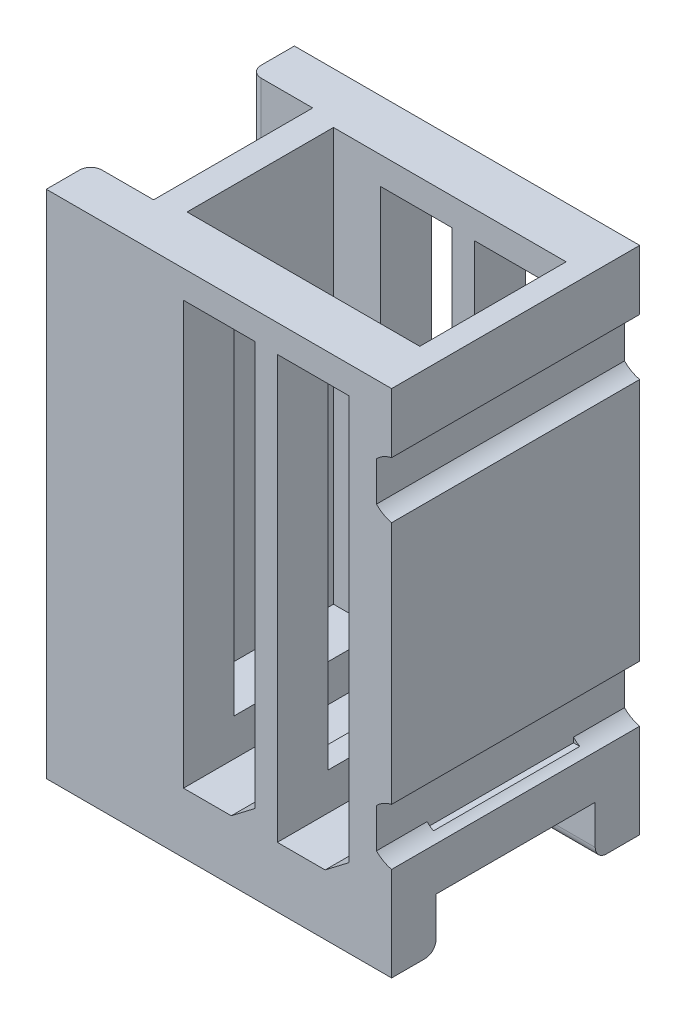
from build123d import *

# Parameters (mm, degrees)
BOSS_EXTRUDE1_DEPTH = 55
SKETCH2_W           = 46
SKETCH2_H           = 13
BOSS_EXTRUDE2_DEPTH = 33.046593186
CUT_EXTRUDE1_DEPTH  = 77.370876735
SKETCH4_W           = 3
SKETCH4_H           = 21.2
CUT_EXTRUDE2_DEPTH  = 81.445701024
CUT_EXTRUDE5_DEPTH  = 55
BOSS_EXTRUDE3_START = -33.046593
SKETCH6_W           = 29.264894646
SKETCH6_H           = 6.300081486
BOSS_EXTRUDE3_DEPTH = 33.046593
SKETCH7_W           = 21.2
SKETCH7_H           = 6.716582595
CUT_EXTRUDE6_DEPTH  = 77.370876735
SKETCH8_W           = 3.134420474
SKETCH8_H           = 7.5
CUT_EXTRUDE7_DEPTH  = 55
FILLET1_R           = 4
BOSS_EXTRUDE4_START = -33.046593
SKETCH9_W           = 1.727441698
SKETCH9_H           = 54.56683481
BOSS_EXTRUDE4_DEPTH = 33.046593
SKETCH10_W          = 0.74410578
SKETCH10_H          = 19.5
CUT_EXTRUDE8_DEPTH  = 59.962432577
FILLET2_R           = 1.5


with BuildPart() as part:
    # Sketch1 → Boss-Extrude1 (new body)
    with BuildSketch(Plane(origin=(0, 0, 0), x_dir=(1, 0, 0), z_dir=(0, 1, 0))):
        Polygon((31, -3.75), (31, 0), (0, 0), (0, 19.5), (31, 19.5), (31, 23.296593186), (34, 23.296593186), (34, 26.296593186), (-12, 26.296593186), (-12, -6.75), (34, -6.75), (34, -3.75), align=None)
        Polygon((31, 9.75), (31, 0), (31, -3.75), (34, -3.75), (34, 23.296593186), (31, 23.296593186), (31, 19.5), align=None)
    extrude(amount=BOSS_EXTRUDE1_DEPTH)

    # Sketch2 → Boss-Extrude2 (add)
    with BuildSketch(Plane.XY.offset(6.75)):
        with Locations((11, -6.5)):
            Rectangle(SKETCH2_W, SKETCH2_H)
    extrude(amount=-BOSS_EXTRUDE2_DEPTH)

    # Sketch3 → Cut-Extrude1 (cut, through all)
    with BuildSketch(Plane(origin=(34, 0, 0), x_dir=(0, 0, -1), z_dir=(1, 0, 0))):
        Polygon((-0.826703407, -6.283417405), (-0.826703407, -13), (9.773296593, -13), (20.373296593, -13), (20.373296593, -6.283417405), align=None)
    extrude(amount=-CUT_EXTRUDE1_DEPTH, mode=Mode.SUBTRACT)

    # Sketch4 → Cut-Extrude2 (cut, through all)
    with BuildSketch(Plane(origin=(0, 55, 0), x_dir=(1, 0, 0), z_dir=(0, 1, 0))):
        with Locations((-5.132099024, 9.773296593)):
            Rectangle(SKETCH4_W, SKETCH4_H)
        Polygon((-12, 20.373296593), (-12, 9.773296593), (-12, -0.826703407), (-6.632099024, -0.826703407), (-6.632099024, 20.373296593), align=None)
    extrude(amount=-CUT_EXTRUDE2_DEPTH, mode=Mode.SUBTRACT)

    # Sketch5 → Cut-Extrude5 (cut)
    with BuildSketch(Plane.XY.offset(6.75)):
        Polygon((28.325224087, 51.33184393), (18.77348764, 51.33184393), (18.77348764, 44.015620269), (18.77348764, -9.839915018), (28.325224087, -2.523691356), align=None)
        Polygon((6.27348764, -9.839915018), (6.27348764, 44.015620269), (6.27348764, 51.33184393), (15.825224087, 51.33184393), (15.825224087, -2.523691356), align=None)
    extrude(amount=-CUT_EXTRUDE5_DEPTH, mode=Mode.SUBTRACT)

    # Sketch6 → Boss-Extrude3 (add)
    with BuildSketch(Plane.XY.offset(6.75).offset(BOSS_EXTRUDE3_START)):
        with Locations((18.265416553, -8.11247332)):
            Rectangle(SKETCH6_W, SKETCH6_H)
    extrude(amount=BOSS_EXTRUDE3_DEPTH)

    # Sketch7 → Cut-Extrude6 (cut, through all)
    with BuildSketch(Plane(origin=(34, 0, 0), x_dir=(0, 0, -1), z_dir=(1, 0, 0))):
        with Locations((9.773296593, -9.641708703)):
            Rectangle(SKETCH7_W, SKETCH7_H)
    extrude(amount=-CUT_EXTRUDE6_DEPTH, mode=Mode.SUBTRACT)

    # Sketch8 → Cut-Extrude7 (cut)
    with BuildSketch(Plane.XY.offset(6.75)):
        with Locations((32.432789763, 3.278045091)):
            Rectangle(SKETCH8_W, SKETCH8_H)
        with Locations((32.432789763, 43.278045091)):
            Rectangle(SKETCH8_W, SKETCH8_H)
    extrude(amount=-CUT_EXTRUDE7_DEPTH, mode=Mode.SUBTRACT)

    # Fillet1
    # the kernel refuses this fillet: 4 mm, written as the material it adds along each edge
    with BuildSketch(Plane(origin=(30.865579526, -0.471954909, 6.75), x_dir=(1, 0, 0), z_dir=(0, 0, -1))) as fillet1_piece_1_section:
        with BuildLine():
            CenterArc((4, -3.905223692), FILLET1_R, 102.497374798, 77.502625202)
            Line((0, -3.905223692), (-0.08, -3.905223692))
            Line((-0.08, -3.905223692), (-0.08, 0))
            Line((-0.08, 0), (0, 0.08))
            ThreePointArc((0, 0.08), (1.567210237, 0.08), (3.117108884, 0.078104474))
            Line((3.117108884, 0.078104474), (3.134420474, 0))
        make_face()
    fillet1_piece_1 = extrude(amount=33.046593186, mode=Mode.PRIVATE)
    fillet1_piece_1 = split(fillet1_piece_1, bisect_by=Plane(origin=(32.12921107, 0, 3.375), z_dir=(0, -1, 0)), keep=Keep.TOP, mode=Mode.PRIVATE)
    fillet1_piece_1 = split(fillet1_piece_1, bisect_by=Plane(origin=(32.12921107, -0.298742451, 0), z_dir=(0, 0, 1)), keep=Keep.TOP, mode=Mode.PRIVATE)
    add(fillet1_piece_1)
    with BuildSketch(Plane(origin=(30.865579526, -0.471954909, 6.75), x_dir=(1, 0, 0), z_dir=(0, 0, -1))) as fillet1_piece_2_section:
        with BuildLine():
            CenterArc((4, -3.905223692), FILLET1_R, 102.497374798, 77.502625202)
            Line((0, -3.905223692), (-0.08, -3.905223692))
            Line((-0.08, -3.905223692), (-0.08, 0))
            Line((-0.08, 0), (0, 0.08))
            ThreePointArc((0, 0.08), (1.567210237, 0.08), (3.117108884, 0.078104474))
            Line((3.117108884, 0.078104474), (3.134420474, 0))
        make_face()
    fillet1_piece_2 = extrude(amount=33.046593186, mode=Mode.PRIVATE)
    fillet1_piece_2 = split(fillet1_piece_2, bisect_by=Plane(origin=(31.341073978, 0, 3.375), z_dir=(0, 1, 0)), keep=Keep.TOP, mode=Mode.PRIVATE)
    fillet1_piece_2 = split(fillet1_piece_2, bisect_by=Plane(origin=(31.341073978, 0.922666131, 0), z_dir=(0, 0, 1)), keep=Keep.TOP, mode=Mode.PRIVATE)
    add(fillet1_piece_2)
    with BuildSketch(Plane(origin=(30.865579526, -0.471954909, 6.75), x_dir=(1, 0, 0), z_dir=(0, 0, -1))) as fillet1_piece_3_section:
        with BuildLine():
            CenterArc((4, -3.905223692), FILLET1_R, 102.497374798, 77.502625202)
            Line((0, -3.905223692), (-0.08, -3.905223692))
            Line((-0.08, -3.905223692), (-0.08, 0))
            Line((-0.08, 0), (0, 0.08))
            ThreePointArc((0, 0.08), (1.567210237, 0.08), (3.117108884, 0.078104474))
            Line((3.117108884, 0.078104474), (3.134420474, 0))
        make_face()
    fillet1_piece_3 = extrude(amount=33.046593186, mode=Mode.PRIVATE)
    fillet1_piece_3 = split(fillet1_piece_3, bisect_by=Plane(origin=(32.12921107, -0.298742451, -19.5), z_dir=(0, 0, 1)), keep=Keep.TOP, mode=Mode.PRIVATE)
    fillet1_piece_3 = split(fillet1_piece_3, bisect_by=Plane(origin=(32.12921107, 0, -9.75), z_dir=(0, -1, 0)), keep=Keep.TOP, mode=Mode.PRIVATE)
    fillet1_piece_3 = split(fillet1_piece_3, bisect_by=Plane(origin=(32.12921107, -0.298742451, 0), z_dir=(0, 0, -1)), keep=Keep.TOP, mode=Mode.PRIVATE)
    add(fillet1_piece_3)
    with BuildSketch(Plane(origin=(30.865579526, -0.471954909, 6.75), x_dir=(1, 0, 0), z_dir=(0, 0, -1))) as fillet1_piece_4_section:
        with BuildLine():
            CenterArc((4, -3.905223692), FILLET1_R, 102.497374798, 77.502625202)
            Line((0, -3.905223692), (-0.08, -3.905223692))
            Line((-0.08, -3.905223692), (-0.08, 0))
            Line((-0.08, 0), (0, 0.08))
            ThreePointArc((0, 0.08), (1.567210237, 0.08), (3.117108884, 0.078104474))
            Line((3.117108884, 0.078104474), (3.134420474, 0))
        make_face()
    fillet1_piece_4 = extrude(amount=33.046593186, mode=Mode.PRIVATE)
    fillet1_piece_4 = split(fillet1_piece_4, bisect_by=Plane(origin=(32.12921107, -0.298742451, -19.5), z_dir=(0, 0, -1)), keep=Keep.TOP, mode=Mode.PRIVATE)
    fillet1_piece_4 = split(fillet1_piece_4, bisect_by=Plane(origin=(32.12921107, 0, -22.898296593), z_dir=(0, -1, 0)), keep=Keep.TOP, mode=Mode.PRIVATE)
    add(fillet1_piece_4)
    with BuildSketch(Plane(origin=(30.865579526, -0.471954909, 6.75), x_dir=(1, 0, 0), z_dir=(0, 0, -1))) as fillet1_piece_5_section:
        with BuildLine():
            CenterArc((4, -3.905223692), FILLET1_R, 102.497374798, 77.502625202)
            Line((0, -3.905223692), (-0.08, -3.905223692))
            Line((-0.08, -3.905223692), (-0.08, 0))
            Line((-0.08, 0), (0, 0.08))
            ThreePointArc((0, 0.08), (1.567210237, 0.08), (3.117108884, 0.078104474))
            Line((3.117108884, 0.078104474), (3.134420474, 0))
        make_face()
    fillet1_piece_5 = extrude(amount=33.046593186, mode=Mode.PRIVATE)
    fillet1_piece_5 = split(fillet1_piece_5, bisect_by=Plane(origin=(31.341073978, 0.922666131, -19.5), z_dir=(0, 0, -1)), keep=Keep.TOP, mode=Mode.PRIVATE)
    fillet1_piece_5 = split(fillet1_piece_5, bisect_by=Plane(origin=(31.341073978, 0, -22.898296593), z_dir=(0, 1, 0)), keep=Keep.TOP, mode=Mode.PRIVATE)
    add(fillet1_piece_5)
    with BuildSketch(Plane(origin=(30.865579526, 7.028045091, -9.73694077), x_dir=(0, -1, 0), z_dir=(0, 0, -1))) as fillet1_piece_6_section:
        with BuildLine():
            CenterArc((3.905223692, -4), FILLET1_R, 90, 77.502625202)
            Line((0, -3.134420474), (-0.078104474, -3.117108884))
            ThreePointArc((-0.078104474, -3.117108884), (-0.08, -1.567210237), (-0.08, 0))
            Line((-0.08, 0), (0, 0.08))
            Line((0, 0.08), (3.905223692, 0.08))
            Line((3.905223692, 0.08), (3.905223692, 0))
        make_face()
    fillet1_piece_6 = extrude(amount=16.559652417, mode=Mode.PRIVATE)
    fillet1_piece_6 = split(fillet1_piece_6, bisect_by=Plane(origin=(31.850173209, 6.325117435, -19.5), z_dir=(0, 0, 1)), keep=Keep.TOP, mode=Mode.PRIVATE)
    fillet1_piece_6 = split(fillet1_piece_6, bisect_by=Plane(origin=(31, 6.325117435, -14.618470385), z_dir=(1, 0, 0)), keep=Keep.TOP, mode=Mode.PRIVATE)
    add(fillet1_piece_6)
    with BuildSketch(Plane(origin=(30.865579526, 7.028045091, -19.5), x_dir=(0, -1, 0), z_dir=(0, 0, -1))) as fillet1_piece_7_section:
        with BuildLine():
            CenterArc((3.905223692, -4), FILLET1_R, 90, 77.502625202)
            Line((0, -3.134420474), (-0.078104474, -3.117108884))
            ThreePointArc((-0.078104474, -3.117108884), (-0.08, -1.567210237), (-0.08, 0))
            Line((-0.08, 0), (0, 0.08))
            Line((0, 0.08), (3.905223692, 0.08))
            Line((3.905223692, 0.08), (3.905223692, 0))
        make_face()
    fillet1_piece_7 = extrude(amount=6.796593186, mode=Mode.PRIVATE)
    fillet1_piece_7 = split(fillet1_piece_7, bisect_by=Plane(origin=(31, 5.302848629, -22.898296593), z_dir=(-1, 0, 0)), keep=Keep.TOP, mode=Mode.PRIVATE)
    add(fillet1_piece_7)
    with BuildSketch(Plane(origin=(30.865579526, 7.028045091, -19.5), x_dir=(0, -1, 0), z_dir=(0, 0, -1))) as fillet1_piece_8_section:
        with BuildLine():
            CenterArc((3.905223692, -4), FILLET1_R, 90, 77.502625202)
            Line((0, -3.134420474), (-0.078104474, -3.117108884))
            ThreePointArc((-0.078104474, -3.117108884), (-0.08, -1.567210237), (-0.08, 0))
            Line((-0.08, 0), (0, 0.08))
            Line((0, 0.08), (3.905223692, 0.08))
            Line((3.905223692, 0.08), (3.905223692, 0))
        make_face()
    fillet1_piece_8 = extrude(amount=6.796593186, mode=Mode.PRIVATE)
    fillet1_piece_8 = split(fillet1_piece_8, bisect_by=Plane(origin=(31, 6.325117435, -22.898296593), z_dir=(1, 0, 0)), keep=Keep.TOP, mode=Mode.PRIVATE)
    add(fillet1_piece_8)
    with BuildSketch(Plane(origin=(30.865579526, 7.028045091, 6.75), x_dir=(0, -1, 0), z_dir=(0, 0, -1))) as fillet1_piece_9_section:
        with BuildLine():
            CenterArc((3.905223692, -4), FILLET1_R, 90, 77.502625202)
            Line((0, -3.134420474), (-0.078104474, -3.117108884))
            ThreePointArc((-0.078104474, -3.117108884), (-0.08, -1.567210237), (-0.08, 0))
            Line((-0.08, 0), (0, 0.08))
            Line((0, 0.08), (3.905223692, 0.08))
            Line((3.905223692, 0.08), (3.905223692, 0))
        make_face()
    fillet1_piece_9 = extrude(amount=6.75, mode=Mode.PRIVATE)
    fillet1_piece_9 = split(fillet1_piece_9, bisect_by=Plane(origin=(31, 5.302848629, 3.375), z_dir=(-1, 0, 0)), keep=Keep.TOP, mode=Mode.PRIVATE)
    add(fillet1_piece_9)
    with BuildSketch(Plane(origin=(30.865579526, 7.028045091, 6.75), x_dir=(0, -1, 0), z_dir=(0, 0, -1))) as fillet1_piece_10_section:
        with BuildLine():
            CenterArc((3.905223692, -4), FILLET1_R, 90, 77.502625202)
            Line((0, -3.134420474), (-0.078104474, -3.117108884))
            ThreePointArc((-0.078104474, -3.117108884), (-0.08, -1.567210237), (-0.08, 0))
            Line((-0.08, 0), (0, 0.08))
            Line((0, 0.08), (3.905223692, 0.08))
            Line((3.905223692, 0.08), (3.905223692, 0))
        make_face()
    fillet1_piece_10 = extrude(amount=6.75, mode=Mode.PRIVATE)
    fillet1_piece_10 = split(fillet1_piece_10, bisect_by=Plane(origin=(31, 6.325117435, 3.375), z_dir=(1, 0, 0)), keep=Keep.TOP, mode=Mode.PRIVATE)
    add(fillet1_piece_10)
    with BuildSketch(Plane(origin=(30.865579526, 7.028045091, 6.75), x_dir=(0, -1, 0), z_dir=(0, 0, -1))) as fillet1_piece_11_section:
        with BuildLine():
            CenterArc((3.905223692, -4), FILLET1_R, 90, 77.502625202)
            Line((0, -3.134420474), (-0.078104474, -3.117108884))
            ThreePointArc((-0.078104474, -3.117108884), (-0.08, -1.567210237), (-0.08, 0))
            Line((-0.08, 0), (0, 0.08))
            Line((0, 0.08), (3.905223692, 0.08))
            Line((3.905223692, 0.08), (3.905223692, 0))
        make_face()
    fillet1_piece_11 = extrude(amount=16.51305923, mode=Mode.PRIVATE)
    fillet1_piece_11 = split(fillet1_piece_11, bisect_by=Plane(origin=(31.850173209, 6.325117435, 0), z_dir=(0, 0, -1)), keep=Keep.TOP, mode=Mode.PRIVATE)
    fillet1_piece_11 = split(fillet1_piece_11, bisect_by=Plane(origin=(31, 6.325117435, -4.881529615), z_dir=(1, 0, 0)), keep=Keep.TOP, mode=Mode.PRIVATE)
    add(fillet1_piece_11)
    with BuildSketch(Plane(origin=(30.865579526, 47.028045091, -9.73694077), x_dir=(1, 0, 0), z_dir=(0, 0, -1))) as fillet1_piece_12_section:
        with BuildLine():
            CenterArc((4, 3.905223692), FILLET1_R, 180, 77.502625202)
            Line((0, 3.905223692), (-0.08, 3.905223692))
            Line((-0.08, 3.905223692), (-0.08, 0))
            Line((-0.08, 0), (0, -0.08))
            ThreePointArc((0, -0.08), (1.567210237, -0.08), (3.117108884, -0.078104474))
            Line((3.117108884, -0.078104474), (3.134420474, 0))
        make_face()
    fillet1_piece_12 = extrude(amount=16.559652417, mode=Mode.PRIVATE)
    fillet1_piece_12 = split(fillet1_piece_12, bisect_by=Plane(origin=(31, 46.325117435, -14.618470385), z_dir=(1, 0, 0)), keep=Keep.TOP, mode=Mode.PRIVATE)
    fillet1_piece_12 = split(fillet1_piece_12, bisect_by=Plane(origin=(31.850173209, 46.325117435, -19.5), z_dir=(0, 0, 1)), keep=Keep.TOP, mode=Mode.PRIVATE)
    add(fillet1_piece_12)
    with BuildSketch(Plane(origin=(30.865579526, 47.028045091, -19.5), x_dir=(1, 0, 0), z_dir=(0, 0, -1))) as fillet1_piece_13_section:
        with BuildLine():
            CenterArc((4, 3.905223692), FILLET1_R, 180, 77.502625202)
            Line((0, 3.905223692), (-0.08, 3.905223692))
            Line((-0.08, 3.905223692), (-0.08, 0))
            Line((-0.08, 0), (0, -0.08))
            ThreePointArc((0, -0.08), (1.567210237, -0.08), (3.117108884, -0.078104474))
            Line((3.117108884, -0.078104474), (3.134420474, 0))
        make_face()
    fillet1_piece_13 = extrude(amount=6.796593186, mode=Mode.PRIVATE)
    fillet1_piece_13 = split(fillet1_piece_13, bisect_by=Plane(origin=(31, 46.325117435, -22.898296593), z_dir=(1, 0, 0)), keep=Keep.TOP, mode=Mode.PRIVATE)
    add(fillet1_piece_13)
    with BuildSketch(Plane(origin=(30.865579526, 47.028045091, -19.5), x_dir=(1, 0, 0), z_dir=(0, 0, -1))) as fillet1_piece_14_section:
        with BuildLine():
            CenterArc((4, 3.905223692), FILLET1_R, 180, 77.502625202)
            Line((0, 3.905223692), (-0.08, 3.905223692))
            Line((-0.08, 3.905223692), (-0.08, 0))
            Line((-0.08, 0), (0, -0.08))
            ThreePointArc((0, -0.08), (1.567210237, -0.08), (3.117108884, -0.078104474))
            Line((3.117108884, -0.078104474), (3.134420474, 0))
        make_face()
    fillet1_piece_14 = extrude(amount=6.796593186, mode=Mode.PRIVATE)
    fillet1_piece_14 = split(fillet1_piece_14, bisect_by=Plane(origin=(31, 45.302848629, -22.898296593), z_dir=(-1, 0, 0)), keep=Keep.TOP, mode=Mode.PRIVATE)
    add(fillet1_piece_14)
    with BuildSketch(Plane(origin=(30.865579526, 47.028045091, 6.75), x_dir=(0, -1, 0), z_dir=(0, 0, -1))) as fillet1_piece_15_section:
        with BuildLine():
            CenterArc((3.905223692, -4), FILLET1_R, 90, 77.502625202)
            Line((0, -3.134420474), (-0.078104474, -3.117108884))
            ThreePointArc((-0.078104474, -3.117108884), (-0.08, -1.567210237), (-0.08, 0))
            Line((-0.08, 0), (0, 0.08))
            Line((0, 0.08), (3.905223692, 0.08))
            Line((3.905223692, 0.08), (3.905223692, 0))
        make_face()
    fillet1_piece_15 = extrude(amount=6.75, mode=Mode.PRIVATE)
    fillet1_piece_15 = split(fillet1_piece_15, bisect_by=Plane(origin=(31, 45.302848629, 3.375), z_dir=(-1, 0, 0)), keep=Keep.TOP, mode=Mode.PRIVATE)
    add(fillet1_piece_15)
    with BuildSketch(Plane(origin=(30.865579526, 47.028045091, 6.75), x_dir=(0, -1, 0), z_dir=(0, 0, -1))) as fillet1_piece_16_section:
        with BuildLine():
            CenterArc((3.905223692, -4), FILLET1_R, 90, 77.502625202)
            Line((0, -3.134420474), (-0.078104474, -3.117108884))
            ThreePointArc((-0.078104474, -3.117108884), (-0.08, -1.567210237), (-0.08, 0))
            Line((-0.08, 0), (0, 0.08))
            Line((0, 0.08), (3.905223692, 0.08))
            Line((3.905223692, 0.08), (3.905223692, 0))
        make_face()
    fillet1_piece_16 = extrude(amount=6.75, mode=Mode.PRIVATE)
    fillet1_piece_16 = split(fillet1_piece_16, bisect_by=Plane(origin=(31, 46.325117435, 3.375), z_dir=(1, 0, 0)), keep=Keep.TOP, mode=Mode.PRIVATE)
    add(fillet1_piece_16)
    with BuildSketch(Plane(origin=(30.865579526, 47.028045091, 6.75), x_dir=(0, -1, 0), z_dir=(0, 0, -1))) as fillet1_piece_17_section:
        with BuildLine():
            CenterArc((3.905223692, -4), FILLET1_R, 90, 77.502625202)
            Line((0, -3.134420474), (-0.078104474, -3.117108884))
            ThreePointArc((-0.078104474, -3.117108884), (-0.08, -1.567210237), (-0.08, 0))
            Line((-0.08, 0), (0, 0.08))
            Line((0, 0.08), (3.905223692, 0.08))
            Line((3.905223692, 0.08), (3.905223692, 0))
        make_face()
    fillet1_piece_17 = extrude(amount=16.51305923, mode=Mode.PRIVATE)
    fillet1_piece_17 = split(fillet1_piece_17, bisect_by=Plane(origin=(31.850173209, 46.325117435, 0), z_dir=(0, 0, -1)), keep=Keep.TOP, mode=Mode.PRIVATE)
    fillet1_piece_17 = split(fillet1_piece_17, bisect_by=Plane(origin=(31, 46.325117435, -4.881529615), z_dir=(1, 0, 0)), keep=Keep.TOP, mode=Mode.PRIVATE)
    add(fillet1_piece_17)
    with BuildSketch(Plane(origin=(30.865579526, 39.528045091, -9.73694077), x_dir=(1, 0, 0), z_dir=(0, 0, -1))) as fillet1_piece_18_section:
        with BuildLine():
            CenterArc((4, -3.905223692), FILLET1_R, 102.497374798, 77.502625202)
            Line((0, -3.905223692), (-0.08, -3.905223692))
            Line((-0.08, -3.905223692), (-0.08, 0))
            Line((-0.08, 0), (0, 0.08))
            ThreePointArc((0, 0.08), (1.567210237, 0.08), (3.117108884, 0.078104474))
            Line((3.117108884, 0.078104474), (3.134420474, 0))
        make_face()
    fillet1_piece_18 = extrude(amount=16.559652417, mode=Mode.PRIVATE)
    fillet1_piece_18 = split(fillet1_piece_18, bisect_by=Plane(origin=(31.850173209, 40.230972746, -19.5), z_dir=(0, 0, 1)), keep=Keep.TOP, mode=Mode.PRIVATE)
    fillet1_piece_18 = split(fillet1_piece_18, bisect_by=Plane(origin=(31, 40.230972746, -14.618470385), z_dir=(1, 0, 0)), keep=Keep.TOP, mode=Mode.PRIVATE)
    add(fillet1_piece_18)
    with BuildSketch(Plane(origin=(30.865579526, 39.528045091, -19.5), x_dir=(1, 0, 0), z_dir=(0, 0, -1))) as fillet1_piece_19_section:
        with BuildLine():
            CenterArc((4, -3.905223692), FILLET1_R, 102.497374798, 77.502625202)
            Line((0, -3.905223692), (-0.08, -3.905223692))
            Line((-0.08, -3.905223692), (-0.08, 0))
            Line((-0.08, 0), (0, 0.08))
            ThreePointArc((0, 0.08), (1.567210237, 0.08), (3.117108884, 0.078104474))
            Line((3.117108884, 0.078104474), (3.134420474, 0))
        make_face()
    fillet1_piece_19 = extrude(amount=6.796593186, mode=Mode.PRIVATE)
    fillet1_piece_19 = split(fillet1_piece_19, bisect_by=Plane(origin=(31, 40.230972746, -22.898296593), z_dir=(1, 0, 0)), keep=Keep.TOP, mode=Mode.PRIVATE)
    add(fillet1_piece_19)
    with BuildSketch(Plane(origin=(30.865579526, 39.528045091, -19.5), x_dir=(1, 0, 0), z_dir=(0, 0, -1))) as fillet1_piece_20_section:
        with BuildLine():
            CenterArc((4, -3.905223692), FILLET1_R, 102.497374798, 77.502625202)
            Line((0, -3.905223692), (-0.08, -3.905223692))
            Line((-0.08, -3.905223692), (-0.08, 0))
            Line((-0.08, 0), (0, 0.08))
            ThreePointArc((0, 0.08), (1.567210237, 0.08), (3.117108884, 0.078104474))
            Line((3.117108884, 0.078104474), (3.134420474, 0))
        make_face()
    fillet1_piece_20 = extrude(amount=6.796593186, mode=Mode.PRIVATE)
    fillet1_piece_20 = split(fillet1_piece_20, bisect_by=Plane(origin=(31, 41.253241553, -22.898296593), z_dir=(-1, 0, 0)), keep=Keep.TOP, mode=Mode.PRIVATE)
    add(fillet1_piece_20)
    with BuildSketch(Plane(origin=(30.865579526, 39.528045091, 6.75), x_dir=(1, 0, 0), z_dir=(0, 0, -1))) as fillet1_piece_21_section:
        with BuildLine():
            CenterArc((4, -3.905223692), FILLET1_R, 102.497374798, 77.502625202)
            Line((0, -3.905223692), (-0.08, -3.905223692))
            Line((-0.08, -3.905223692), (-0.08, 0))
            Line((-0.08, 0), (0, 0.08))
            ThreePointArc((0, 0.08), (1.567210237, 0.08), (3.117108884, 0.078104474))
            Line((3.117108884, 0.078104474), (3.134420474, 0))
        make_face()
    fillet1_piece_21 = extrude(amount=6.75, mode=Mode.PRIVATE)
    fillet1_piece_21 = split(fillet1_piece_21, bisect_by=Plane(origin=(31, 40.230972746, 3.375), z_dir=(1, 0, 0)), keep=Keep.TOP, mode=Mode.PRIVATE)
    add(fillet1_piece_21)
    with BuildSketch(Plane(origin=(30.865579526, 39.528045091, 6.75), x_dir=(1, 0, 0), z_dir=(0, 0, -1))) as fillet1_piece_22_section:
        with BuildLine():
            CenterArc((4, -3.905223692), FILLET1_R, 102.497374798, 77.502625202)
            Line((0, -3.905223692), (-0.08, -3.905223692))
            Line((-0.08, -3.905223692), (-0.08, 0))
            Line((-0.08, 0), (0, 0.08))
            ThreePointArc((0, 0.08), (1.567210237, 0.08), (3.117108884, 0.078104474))
            Line((3.117108884, 0.078104474), (3.134420474, 0))
        make_face()
    fillet1_piece_22 = extrude(amount=6.75, mode=Mode.PRIVATE)
    fillet1_piece_22 = split(fillet1_piece_22, bisect_by=Plane(origin=(31, 41.253241553, 3.375), z_dir=(-1, 0, 0)), keep=Keep.TOP, mode=Mode.PRIVATE)
    add(fillet1_piece_22)
    with BuildSketch(Plane(origin=(30.865579526, 39.528045091, 6.75), x_dir=(1, 0, 0), z_dir=(0, 0, -1))) as fillet1_piece_23_section:
        with BuildLine():
            CenterArc((4, -3.905223692), FILLET1_R, 102.497374798, 77.502625202)
            Line((0, -3.905223692), (-0.08, -3.905223692))
            Line((-0.08, -3.905223692), (-0.08, 0))
            Line((-0.08, 0), (0, 0.08))
            ThreePointArc((0, 0.08), (1.567210237, 0.08), (3.117108884, 0.078104474))
            Line((3.117108884, 0.078104474), (3.134420474, 0))
        make_face()
    fillet1_piece_23 = extrude(amount=16.51305923, mode=Mode.PRIVATE)
    fillet1_piece_23 = split(fillet1_piece_23, bisect_by=Plane(origin=(31, 40.230972746, -4.881529615), z_dir=(1, 0, 0)), keep=Keep.TOP, mode=Mode.PRIVATE)
    fillet1_piece_23 = split(fillet1_piece_23, bisect_by=Plane(origin=(31.850173209, 40.230972746, 0), z_dir=(0, 0, -1)), keep=Keep.TOP, mode=Mode.PRIVATE)
    add(fillet1_piece_23)

    # Sketch9 → Boss-Extrude4 (add)
    with BuildSketch(Plane.XY.offset(6.75).offset(BOSS_EXTRUDE4_START)):
        with Locations((31.119615069, 23.133898568)):
            Rectangle(SKETCH9_W, SKETCH9_H)
    extrude(amount=BOSS_EXTRUDE4_DEPTH)

    # Sketch10 → Cut-Extrude8 (cut)
    with BuildSketch(Plane(origin=(0, 55, 0), x_dir=(1, 0, 0), z_dir=(0, 1, 0))):
        with Locations((30.62794711, 9.75)):
            Rectangle(SKETCH10_W, SKETCH10_H)
    extrude(amount=-CUT_EXTRUDE8_DEPTH, mode=Mode.SUBTRACT)

    # Fillet2
    fillet2_edges = [part.edges().sort_by_distance(p)[0] for p in [
        (-12, 21, -20.373296593),
        (11, -13, -20.373296593),
        (-12, 21, 0.826703407),
        (11, -13, 0.826703407),
    ]]
    fillet(fillet2_edges, radius=FILLET2_R)


solid = part.part
